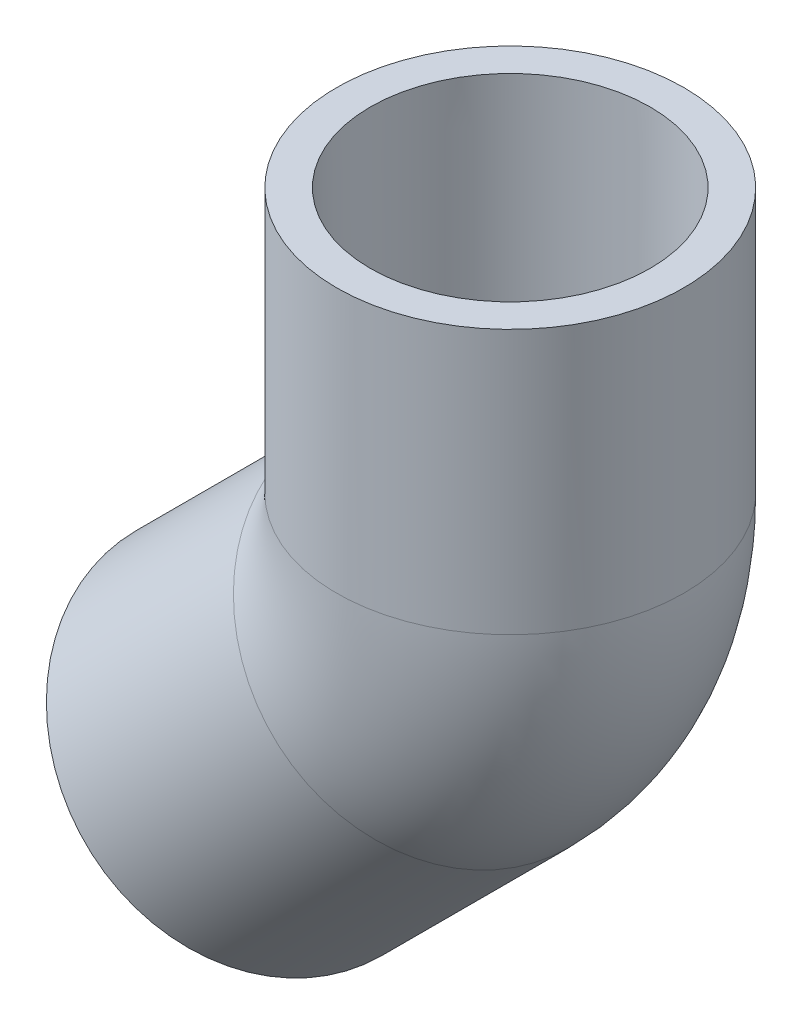
from build123d import *

# Parameters (mm, degrees)
SKETCH3_R   = 16.66875
SKETCH3_R_2 = 10.4648


with BuildPart() as part:
    # Sketch1 → Revolve1 (revolve)
    with BuildSketch(Plane.XY):
        Polygon((-12.347852166, -35.921024484), (5.612660076, -17.960512242), (3.219421819, -15.567273986), (-14.633327349, -33.635549301), align=None)
    revolve(axis=Axis((-24.134438325, -24.134438325, 0), (0.7071067811865486, 0.7071067811865465, 0)))



with BuildPart() as body_2:
    # Sketch2 → Revolve2 (revolve)
    with BuildSketch(Plane.XY):
        Polygon((13.4366, 34.13125), (13.2842, 8.73125), (16.66875, 8.73125), (16.66875, 34.13125), align=None)
    revolve(axis=Axis((0, 0, 0), (0, 1, 0)))


with BuildPart() as part_1:
    add(part.part)

    add(body_2.part)  # Sweep1 merges body 2
    # Sweep1: sweep along a path in Sketch4
    with BuildLine(Plane.XY) as sweep1_path:
        ThreePointArc((-6.173926083, -6.173926083), (-1.604551111, 0.664626832), (0, 8.73125))
    # Sketch3 → Sweep1 (sweep)
    with BuildSketch(Plane(origin=(-6.173926083, -6.173926083, 0), x_dir=(0, 0, -1), z_dir=(0.7071067811865488, 0.7071067811865464, 0))):
        Circle(SKETCH3_R)
        Circle(SKETCH3_R_2, mode=Mode.SUBTRACT)
    sweep(path=sweep1_path.line)


solid = part_1.part
